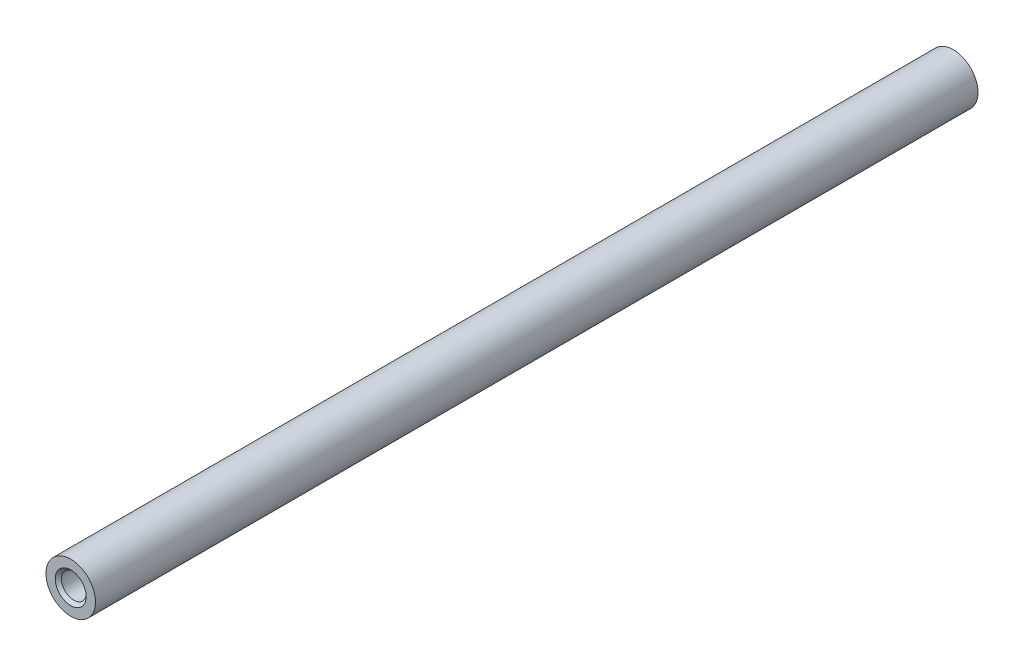
from build123d import *

# Parameters (mm, degrees)
SZKIC1_R                    = 8
SZKIC1_R_2                  = 4
DODANIE_WYCI_GNI_CIE1_DEPTH = 142.5
SZKIC2_R                    = 5
WYTNIJ_WYCI_GNI_CIE1_DEPTH  = 30
SFAZOWANIE1_SIZE            = 1


with BuildPart() as part:
    # Szkic1 → Dodanie-wyciągnięcie1 (new, symmetric)
    with BuildSketch(Plane.XY):
        Circle(SZKIC1_R)
        Circle(SZKIC1_R_2, mode=Mode.SUBTRACT)
    extrude(amount=DODANIE_WYCI_GNI_CIE1_DEPTH, both=True)

    # Szkic2 → Wytnij-wyciągnięcie1 (cut)
    with BuildSketch(Plane(origin=(0, 0, -142.5), x_dir=(-1, 0, 0), z_dir=(0, 0, -1))):
        Circle(SZKIC2_R)
    extrude(amount=-WYTNIJ_WYCI_GNI_CIE1_DEPTH, mode=Mode.SUBTRACT)

    # Sfazowanie1
    sfazowanie1_edges = [part.edges().sort_by_distance(p)[0] for p in [
        (-4, 0, 142.5),
    ]]
    chamfer(sfazowanie1_edges, length=SFAZOWANIE1_SIZE)


solid = part.part
